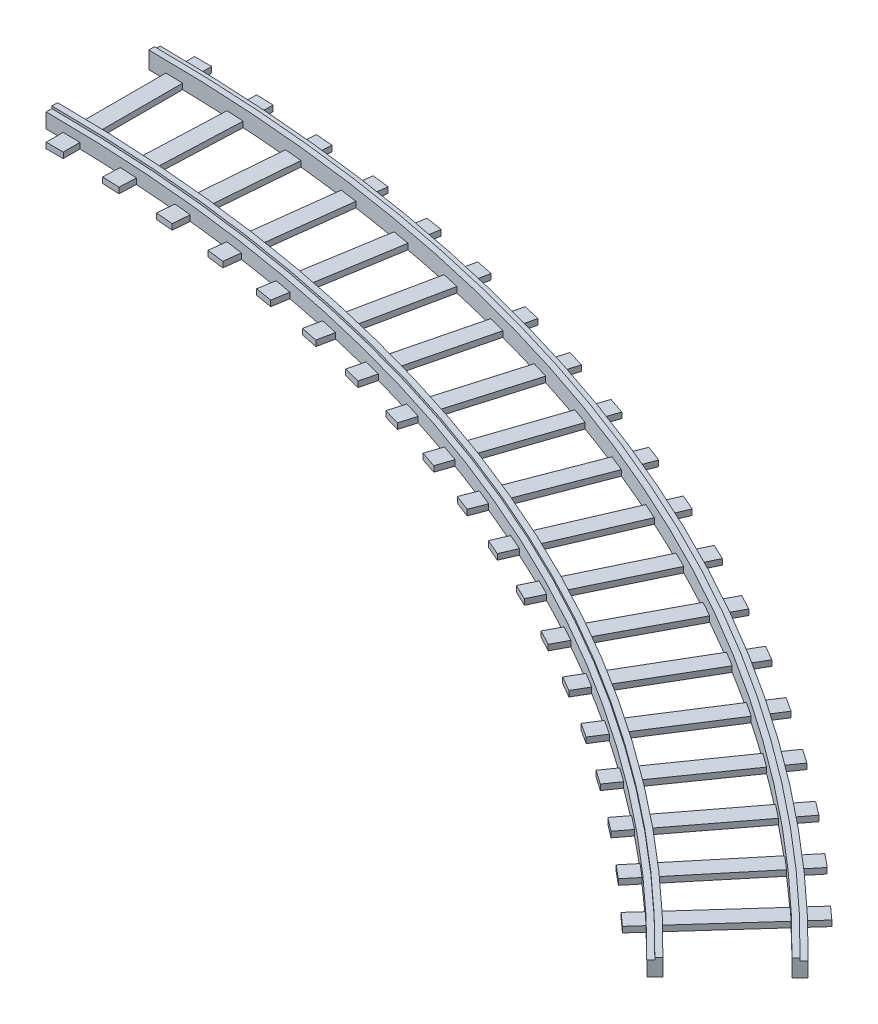
from build123d import *

# Parameters (mm, degrees)
BOSS_EXTRUDE1_DEPTH   = 3
BOSS_EXTRUDE1_2_DEPTH = 3
BOSS_EXTRUDE7_DEPTH   = 2.6
SKETCH9_W             = 3
SKETCH9_H             = 26
BOSS_EXTRUDE9_DEPTH   = 1
CIRPATTERN3_COUNT     = 19
CIRPATTERN3_ANGLE     = 42


with BuildPart() as part:
    # Sketch1 → Boss-Extrude1 (new body)
    with BuildSketch(Plane(origin=(0, 0, 0), x_dir=(1, 0, 0), z_dir=(0, 1, 0))):
        with BuildLine():
            Line((182.851365118, 179.525599218), (182.137798815, 178.825011513))
            ThreePointArc((182.137798815, 178.825011513), (98.761020426, 235.36954634), (0, 255.25))
            Line((0, 255.25), (0, 256.25))
            ThreePointArc((0, 256.25), (99.147939213, 236.291660136), (182.851365118, 179.525599218))
        make_face()
    extrude(amount=BOSS_EXTRUDE1_DEPTH)



with BuildPart() as body_2:
    # Sketch1 → Boss-Extrude1 2 (new body)
    with BuildSketch(Plane(origin=(0, 0, 0), x_dir=(1, 0, 0), z_dir=(0, 1, 0))):
        with BuildLine():
            Line((194.268425964, 190.735002486), (194.981992267, 191.43559019))
            ThreePointArc((194.981992267, 191.43559019), (105.725558595, 251.967594662), (0, 273.25))
            Line((0, 273.25), (0, 272.25))
            ThreePointArc((0, 272.25), (105.338639808, 251.045480866), (194.268425964, 190.735002486))
        make_face()
    extrude(amount=BOSS_EXTRUDE1_2_DEPTH)


with BuildPart() as part_1:
    add(part.part)

    add(body_2.part)  # Boss-Extrude7 merges body 2
    # Sketch7 → Boss-Extrude7 (add)
    with BuildSketch(Plane.XZ):
        with BuildLine():
            Line((0, -273.25), (0, -274.25))
            ThreePointArc((0, -274.25), (106.112477382, -252.889708458), (195.69555857, -192.136177894))
            Line((195.69555857, -192.136177894), (194.981992267, -191.43559019))
            ThreePointArc((194.981992267, -191.43559019), (105.725558595, -251.967594662), (0, -273.25))
        make_face()
        with BuildLine():
            Line((0, -255.25), (0, -254.25))
            ThreePointArc((0, -254.25), (98.374101639, -234.447432545), (181.424232512, -178.124423809))
            Line((181.424232512, -178.124423809), (182.137798815, -178.825011513))
            ThreePointArc((182.137798815, -178.825011513), (98.761020426, -235.36954634), (0, -255.25))
        make_face()
    extrude(amount=-BOSS_EXTRUDE7_DEPTH)

    # Sketch9 → Boss-Extrude9 (add)
    with BuildSketch(Plane.XZ):
        with Locations((4.5, -264.25)):
            Rectangle(SKETCH9_W, SKETCH9_H)
    boss_extrude9 = extrude(amount=-BOSS_EXTRUDE9_DEPTH)

    # CirPattern3: Boss-Extrude9 ×19 about axis
    cirpattern3_axis = Axis((0, 3, 0), (0, -1, 0))
    for i in range(1, CIRPATTERN3_COUNT):
        add(boss_extrude9.rotate(cirpattern3_axis, i * CIRPATTERN3_ANGLE / (CIRPATTERN3_COUNT - 1)))


solid = part_1.part
